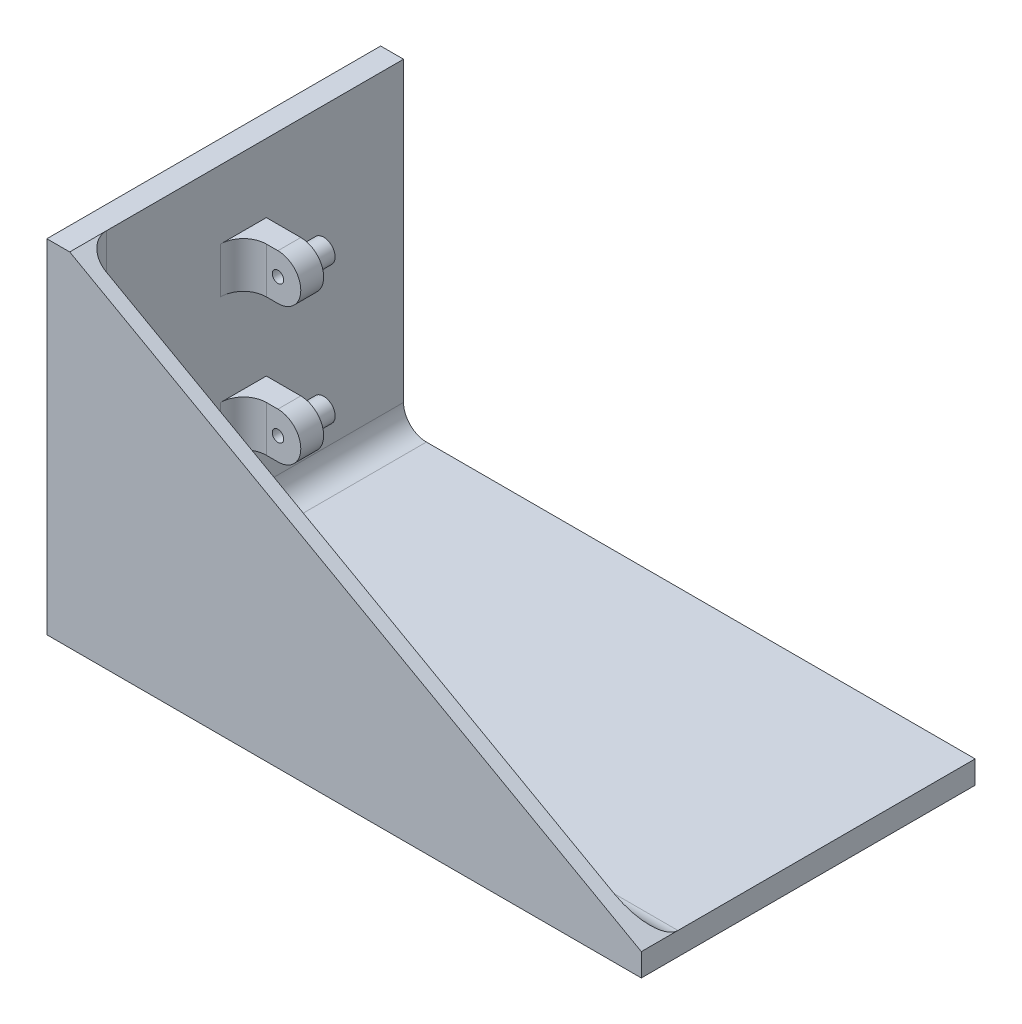
from build123d import *

# Parameters (mm, degrees)
SCHIZZO1_W                   = 5
SCHIZZO1_H                   = 70
ESTRUSIONE_ESTRUSIONE1_DEPTH = 70
ESTRUSIONE_ESTRUSIONE2_START = -35
ESTRUSIONE_ESTRUSIONE2_DEPTH = 5
SCHIZZO3_R                   = 2.5
ESTRUSIONE_ESTRUSIONE3_DEPTH = 5
SCHIZZO4_W                   = 130
SCHIZZO4_H                   = 70
ESTRUSIONE_ESTRUSIONE4_DEPTH = 5
SCHIZZO5_R                   = 1.25
TAGLIO_ESTRUSIONE1_DEPTH     = 151.166574177
ESTRUSIONE_ESTRUSIONE5_DEPTH = 3
RACCORDO1_R                  = 5
RACCORDO2_R                  = 5


with BuildPart() as part:
    # Schizzo1 → Estrusione-Estrusione1 (new body)
    with BuildSketch(Plane.XY):
        with Locations((-2.5, 35)):
            Rectangle(SCHIZZO1_W, SCHIZZO1_H)
    extrude(amount=ESTRUSIONE_ESTRUSIONE1_DEPTH)

    # Schizzo2 → Estrusione-Estrusione2 (add)
    with BuildSketch(Plane.XY.offset(70).offset(ESTRUSIONE_ESTRUSIONE2_START)):
        with BuildLine():
            Line((0, 55), (0, 45))
            Line((0, 45), (7.531619243, 45))
            ThreePointArc((7.531619243, 45), (12.531619243, 50), (7.531619243, 55))
            Line((7.531619243, 55), (0, 55))
        make_face()
        with BuildLine():
            Line((0, 25), (0, 15))
            Line((0, 15), (7.531619243, 15))
            ThreePointArc((7.531619243, 15), (12.531619243, 20), (7.531619243, 25))
            Line((7.531619243, 25), (0, 25))
        make_face()
    extrude(amount=-ESTRUSIONE_ESTRUSIONE2_DEPTH)

    # Schizzo3 → Estrusione-Estrusione3 (add)
    with BuildSketch(Plane(origin=(0, 0, 30), x_dir=(-1, 0, 0), z_dir=(0, 0, -1))):
        with Locations((-7.547600082, 50.061310314)):
            Circle(SCHIZZO3_R)
        with Locations((-7.547600082, 19.939772921)):
            Circle(SCHIZZO3_R)
    extrude(amount=ESTRUSIONE_ESTRUSIONE3_DEPTH)

    # Schizzo4 → Estrusione-Estrusione4 (add)
    with BuildSketch(Plane.XZ):
        with Locations((60, 35)):
            Rectangle(SCHIZZO4_W, SCHIZZO4_H)
    extrude(amount=ESTRUSIONE_ESTRUSIONE4_DEPTH)

    # Schizzo5 → Taglio-Estrusione1 (cut, through all)
    with BuildSketch(Plane(origin=(0, 0, 25), x_dir=(-1, 0, 0), z_dir=(0, 0, -1))):
        with Locations((-7.547600082, 50.061310314)):
            Circle(SCHIZZO5_R)
        with Locations((-7.547600082, 19.939772921)):
            Circle(SCHIZZO5_R)
    extrude(amount=-TAGLIO_ESTRUSIONE1_DEPTH, mode=Mode.SUBTRACT)

    # Schizzo6 → Estrusione-Estrusione5 (add)
    with BuildSketch(Plane.XY.offset(70)):
        Polygon((125, 0), (0, 70), (-5, 70), (-5, -5), (125, -5), align=None)
    extrude(amount=ESTRUSIONE_ESTRUSIONE5_DEPTH)

    # Raccordo1
    raccordo1_edges = [part.edges().sort_by_distance(p)[0] for p in [
        (0, 0, 35),
        (0, 35, 70),
        (62.5, 0, 70),
    ]]
    fillet(raccordo1_edges, radius=RACCORDO1_R)

    # Raccordo2
    raccordo2_edges = [part.edges().sort_by_distance(p)[0] for p in [
        (0, 20, 35),
        (0, 50, 35),
    ]]
    fillet(raccordo2_edges, radius=RACCORDO2_R)


solid = part.part
